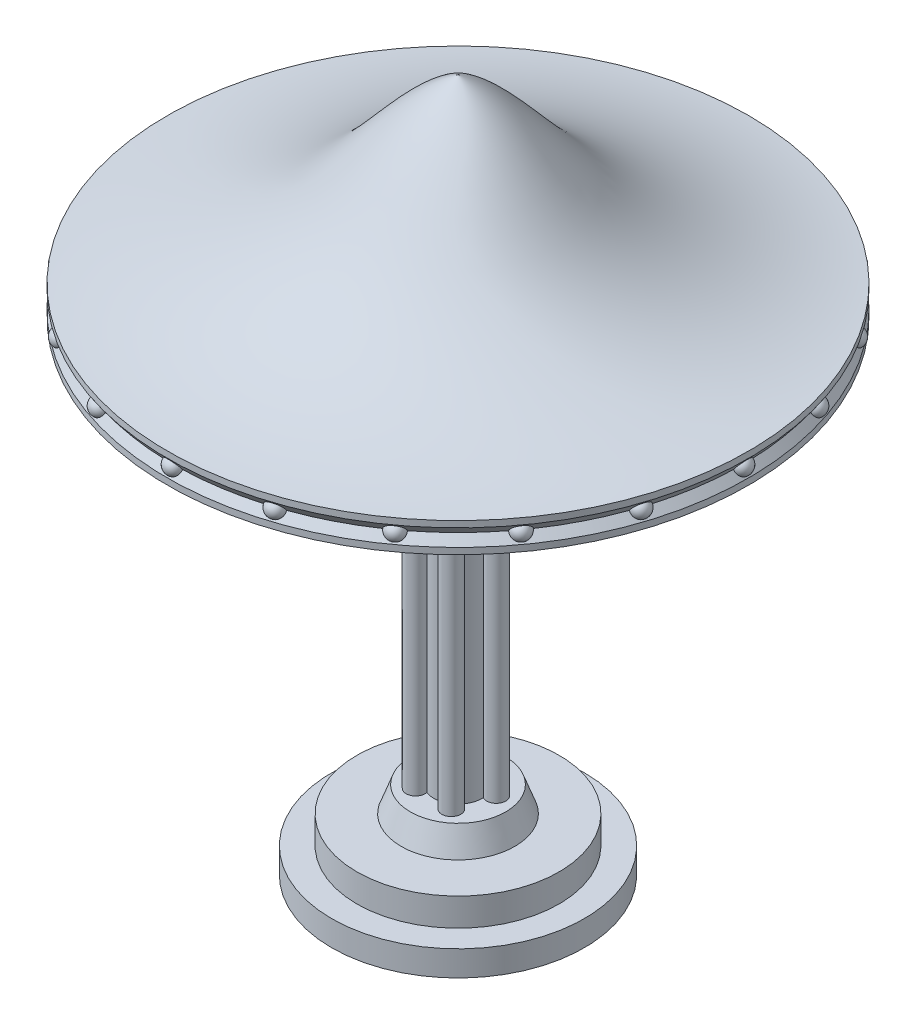
from build123d import *

# Parameters (mm, degrees)
SKETCH1_R           = 12.7
BOSS_EXTRUDE1_DEPTH = 2.54
SKETCH2_R           = 1.905
BOSS_EXTRUDE2_DEPTH = 2.54
SKETCH3_R           = 10.16
BOSS_EXTRUDE3_DEPTH = 2.794
SKETCH4_R           = 5.715
BOSS_EXTRUDE4_DEPTH = 2.54
BOSS_EXTRUDE4_TAPER = 20
SKETCH5_R           = 0.9525
BOSS_EXTRUDE5_DEPTH = 19.05
CIRPATTERN1_COUNT   = 5
SKETCH6_R           = 2.432739214
BOSS_EXTRUDE6_DEPTH = 19.05
MIRROR2_START       = 26.924
MIRROR2_DEPTH       = 19.05
SKETCH7_R           = 4.328273407
BOSS_EXTRUDE7_DEPTH = 2.54
BOSS_EXTRUDE7_DRAFT = -20
CIRPATTERN2_COUNT   = 20


# Read off the part's stored shape, not the designer's step: Mirror2
with BuildPart() as part:
    # Sketch1 → Boss-Extrude1 (new body)
    with BuildSketch(Plane(origin=(0, 0, 0), x_dir=(1, 0, 0), z_dir=(0, 1, 0))):
        with Locations(Location((0, 0, 0), (0, 0, 270))):
            Circle(SKETCH1_R)
    extrude(amount=BOSS_EXTRUDE1_DEPTH)

    # Sketch2 → Boss-Extrude2 (add)
    with BuildSketch(Plane.XZ):
        with Locations(Location((0, 0, 0), (0, 0, 270))):
            Circle(SKETCH2_R)
    extrude(amount=BOSS_EXTRUDE2_DEPTH)

    # Sketch3 → Boss-Extrude3 (add)
    with BuildSketch(Plane(origin=(0, 2.54, 0), x_dir=(1, 0, 0), z_dir=(0, 1, 0))):
        with Locations(Location((0, 0, 0), (0, 0, 270))):
            Circle(SKETCH3_R)
    extrude(amount=BOSS_EXTRUDE3_DEPTH)

    # Sketch4 → Boss-Extrude4 (add)
    with BuildSketch(Plane(origin=(0, 5.334, 0), x_dir=(1, 0, 0), z_dir=(0, 1, 0))):
        Circle(SKETCH4_R)
    extrude(amount=BOSS_EXTRUDE4_DEPTH, taper=BOSS_EXTRUDE4_TAPER)

    # Sketch5 → Boss-Extrude5 (add)
    with BuildSketch(Plane(origin=(0, 7.874, 0), x_dir=(1, 0, 0), z_dir=(0, 1, 0))):
        with Locations(Location((0, 3.048, 0), (0, 0, 90))):
            Circle(SKETCH5_R)
    boss_extrude5 = extrude(amount=BOSS_EXTRUDE5_DEPTH)

    # CirPattern1: Boss-Extrude5 ×5 about axis
    cirpattern1_axis = Axis((0, 0, 0), (0, 1, 0))
    for i in range(1, CIRPATTERN1_COUNT):
        add(boss_extrude5.rotate(cirpattern1_axis, i * 360 / CIRPATTERN1_COUNT))

    # Sketch6 → Boss-Extrude6 (add)
    with BuildSketch(Plane(origin=(0, 7.874, 0), x_dir=(1, 0, 0), z_dir=(0, 1, 0))):
        Circle(SKETCH6_R)
    extrude(amount=BOSS_EXTRUDE6_DEPTH)

    # Mirror2 outline → Mirror2 (add)
    with BuildSketch(Plane(origin=(0, 0, 0), x_dir=(1, 0, 0), z_dir=(0, 1, 0)).offset(MIRROR2_START)):
        with BuildLine():
            ThreePointArc((0.643788931, 2.346008503), (0, 4.0005), (-0.643788931, 2.346008503))
            ThreePointArc((-0.643788931, 2.346008503), (-1.429928232, 1.968127367), (-2.032244953, 1.337236154))
            ThreePointArc((-2.032244953, 1.337236154), (-3.804701593, 1.236222486), (-2.430128394, 0.112676838))
            ThreePointArc((-2.430128394, 0.112676838), (-2.313672482, -0.75175776), (-1.899785385, -1.519551108))
            ThreePointArc((-1.899785385, -1.519551108), (-2.351434903, -3.236472485), (-0.858113014, -2.276370387))
            ThreePointArc((-0.858113014, -2.276370387), (0, -2.432739214), (0.858113014, -2.276370387))
            ThreePointArc((0.858113014, -2.276370387), (2.351434903, -3.236472485), (1.899785385, -1.519551108))
            ThreePointArc((1.899785385, -1.519551108), (2.313672482, -0.75175776), (2.430128394, 0.112676838))
            ThreePointArc((2.430128394, 0.112676838), (3.804701593, 1.236222486), (2.032244953, 1.337236154))
            ThreePointArc((2.032244953, 1.337236154), (1.429928232, 1.968127367), (0.643788931, 2.346008503))
        make_face()
    extrude(amount=MIRROR2_DEPTH)


with BuildPart() as boss_extrude7_tool:
    # Sketch7 → Boss-Extrude7 (with draft: the straight prism first)
    with BuildSketch(Plane(origin=(0, 45.974, 0), x_dir=(1, 0, 0), z_dir=(0, 1, 0))):
        Circle(SKETCH7_R)
    extrude(amount=BOSS_EXTRUDE7_DEPTH)
    # Boss-Extrude7: the draft: its side faces are tilted about the plane it starts from
    boss_extrude7_sides = [boss_extrude7_tool.faces().sort_by_distance(p)[0] for p in [
        (-4.328273407, 47.244, 0),
    ]]
    draft(boss_extrude7_sides, Plane(origin=(0, 45.974, 0), x_dir=(1, 0, 0), z_dir=(0, 1, 0)), BOSS_EXTRUDE7_DRAFT)


with BuildPart() as part_1:
    add(part.part)

    # Boss-Extrude7: add boss_extrude7_tool
    add(boss_extrude7_tool.part)

    # Sketch8 → Revolve1 (revolve)
    with BuildSketch(Plane(origin=(0, 0, 0), x_dir=(0, 0, -1), z_dir=(1, 0, 0))):
        with BuildLine():
            Line((0, 48.514), (5.252757802, 48.514))
            Line((5.252757802, 48.514), (29.21, 48.514))
            Line((29.21, 48.514), (29.21, 49.149))
            Line((29.21, 49.149), (28.582487453, 50.001267966))
            Line((28.582487453, 50.001267966), (29.21, 50.853535932))
            Line((29.21, 50.853535932), (29.21, 51.488535932))
            add(Edge.make_bspline(
                [(29.21, 51.488535932), (22.758943997, 52.0856374), (10.726302211, 56.427382026), (4.711564937, 67.165972903), (0, 69.639479529)],
                knots=[0, 0, 0, 0, 0.560940497, 1, 1, 1, 1], degree=3))
            Line((0, 69.639479529), (0, 48.514))
        make_face()
    revolve(axis=Axis((0, 48.514, 0), (0, 1, 0)))

    # Sketch9 → Revolve2 (revolve)
    with BuildSketch(Plane(origin=(0, 50.001267966, -28.582487453), x_dir=(-1, 0, 0), z_dir=(0, 0, -1))):
        with BuildLine():
            Line((0, 0), (0, 0.889))
            ThreePointArc((0, 0.889), (0.889, 0), (0, -0.889))
            Line((0, -0.889), (0, 0))
        make_face()
    revolve2 = revolve(axis=Axis((0, 50.001267966, -28.582487453), (0, 1, 0)))

    # CirPattern2: Revolve2 ×20 about axis
    cirpattern2_axis = Axis((0, 0, 0), (0, 1, 0))
    for i in range(1, CIRPATTERN2_COUNT):
        add(revolve2.rotate(cirpattern2_axis, i * 360 / CIRPATTERN2_COUNT))


solid = part_1.part
